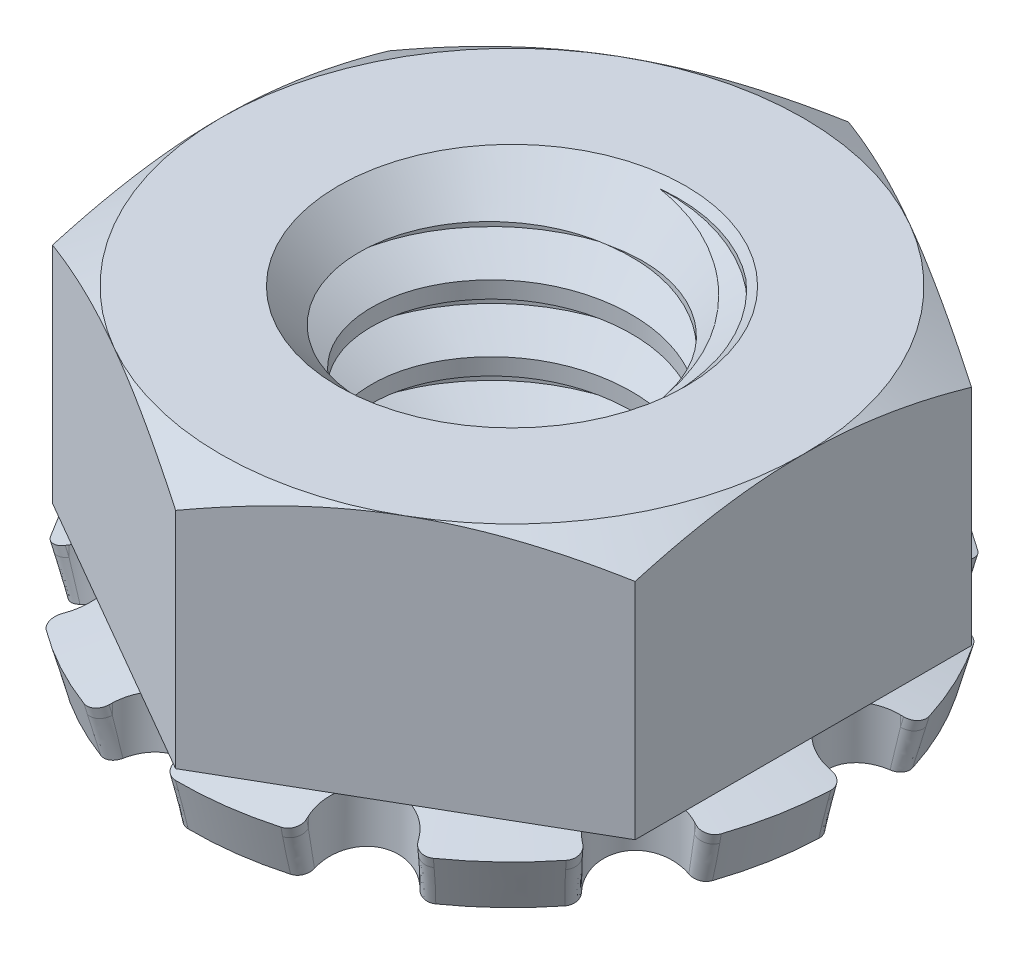
from build123d import *

# Parameters (mm, degrees)
BOSS_EXTRUDE1_DEPTH          = 5.953125
SKETCH2_OUTSIDE_W            = 56.086
SKETCH2_OUTSIDE_H            = 57.806
SKETCH2_OUTSIDE_R            = 5.55625
CUT_EXTRUDE1_DEPTH           = 11.366974651
CUT_EXTRUDE1_DRAFT           = -60
SKETCH4_R                    = 3.175
CUT_EXTRUDE3_DEPTH           = 5.953125
SWEEP1_PITCH                 = 1.27
SKETCH7_R                    = 3.312481533
CUT_EXTRUDE4_OTHER_WAY_DEPTH = 12.17062735
CUT_EXTRUDE4_OTHER_WAY_TAPER = -45
SKETCH8_R                    = 3.312481533
CUT_EXTRUDE5_OTHER_WAY_DEPTH = 11.366974824
CUT_EXTRUDE5_OTHER_WAY_TAPER = -45
SKETCH9_W                    = 2.050179866
SKETCH9_H                    = 1.190625
CUT_EXTRUDE6_DEPTH           = 1.190625
FILLET1_R                    = 0.254
CIRPATTERN1_COUNT            = 10
FILLET1_OF_CIRPATTERN1_R     = 0.254


with BuildPart() as part:
    # Sketch1 → Boss-Extrude1 (new body)
    with BuildSketch(Plane(origin=(0, 0, 0), x_dir=(1, 0, 0), z_dir=(0, 1, 0))):
        Polygon((0, 6.415804866), (-5.55625, 3.207902433), (-5.55625, -3.207902433), (0, -6.415804866), (5.55625, -3.207902433), (5.55625, 3.207902433), align=None)
    extrude(amount=BOSS_EXTRUDE1_DEPTH)


with BuildPart() as cut_extrude1_tool:
    # Sketch2 outside → Cut-Extrude1 (with draft: the straight prism first)
    with BuildSketch(Plane(origin=(0, 5.953125, 0), x_dir=(1, 0, 0), z_dir=(0, 1, 0))):
        Rectangle(SKETCH2_OUTSIDE_W, SKETCH2_OUTSIDE_H)
        Circle(SKETCH2_OUTSIDE_R, mode=Mode.SUBTRACT)
    extrude(amount=-CUT_EXTRUDE1_DEPTH)
    # Cut-Extrude1: the draft: its side faces are tilted about the plane it starts from
    cut_extrude1_sides = [cut_extrude1_tool.faces().sort_by_distance(p)[0] for p in [
        (0, 0.269637675, 28.903),
        (28.043, 0.269637675, 0),
        (0, 0.269637675, -28.903),
        (-28.043, 0.269637675, 0),
        (-5.55625, 0.269637675, 0),
    ]]
    draft(cut_extrude1_sides, Plane(origin=(0, 5.953125, 0), x_dir=(1, 0, 0), z_dir=(0, 1, 0)), CUT_EXTRUDE1_DRAFT)


with BuildPart() as part_1:
    add(part.part)

    # Cut-Extrude1: cut by cut_extrude1_tool
    add(cut_extrude1_tool.part, mode=Mode.SUBTRACT)

    # Sketch4 → Cut-Extrude3 (cut)
    with BuildSketch(Plane(origin=(0, 5.953125, 0), x_dir=(1, 0, 0), z_dir=(0, 1, 0))):
        with Locations(Location((0, 0, 0), (0, 0, 270))):
            Circle(SKETCH4_R)
    extrude(amount=-CUT_EXTRUDE3_DEPTH, mode=Mode.SUBTRACT)

    # Sweep1: the profile of Sketch6 screwed along a right-hand helix of 5.6875 turns, 8 arcs to a turn; built about Z, then put on its axis
    sweep1_z = Axis((0, 0, 0), (0, 0, 1))
    sweep1_corners = [(3.243740766, 0, -1.1509375), (2.487592336, 0, -0.714375), (2.487592336, 0, -0.396875), (3.243740766, 0, 0.0396875)]
    with BuildLine(mode=Mode.PRIVATE) as sweep1_profile:
        Line(sweep1_corners[0], sweep1_corners[1])
        Line(sweep1_corners[1], sweep1_corners[2])
        Line(sweep1_corners[2], sweep1_corners[3])
        Line(sweep1_corners[3], sweep1_corners[0])
    sweep1_cap = Face(sweep1_profile.wire())
    sweep1_turn_angles = [0, 22.5, 45, 67.5, 90, 112.5, 135, 157.5, 180, 202.5, 225, 247.5, 270, 292.5, 315, 337.5, 360]
    sweep1_turn_weights = [1, 0.9238795325112867, 1, 0.9238795325112867, 1, 0.9238795325112867, 1, 0.9238795325112867, 1, 0.9238795325112867, 1, 0.9238795325112867, 1, 0.9238795325112867, 1, 0.9238795325112867, 1]
    sweep1_turn_rails = [Edge.make_bspline([Vector(p[0], p[1], 0).rotate(sweep1_z, sweep1_turn_angles[k]) / sweep1_turn_weights[k] + Vector(0, 0, p[2] + SWEEP1_PITCH * sweep1_turn_angles[k] / 360) for k in range(17)], [0, 0, 0, 1, 1, 2, 2, 3, 3, 4, 4, 5, 5, 6, 6, 7, 7, 8, 8, 8], 2, sweep1_turn_weights) for p in sweep1_corners]
    sweep1_turn_sides = [Face.make_surface_from_curves(sweep1_turn_rails[p[0]], sweep1_turn_rails[p[1]]) for p in [(0, 1), (1, 2), (2, 3), (3, 0)]]
    sweep1_last_angles = [1800, 1822.5, 1845, 1867.5, 1890, 1912.5, 1935, 1957.5, 1980, 2002.5, 2025, 2036.25, 2047.5]
    sweep1_last_weights = [1, 0.9238795325112867, 1, 0.9238795325112867, 1, 0.9238795325112867, 1, 0.9238795325112867, 1, 0.9238795325112867, 1, 0.9807852804032247, 1]
    sweep1_last_rails = [Edge.make_bspline([Vector(p[0], p[1], 0).rotate(sweep1_z, sweep1_last_angles[k]) / sweep1_last_weights[k] + Vector(0, 0, p[2] + SWEEP1_PITCH * sweep1_last_angles[k] / 360) for k in range(13)], [0, 0, 0, 1, 1, 2, 2, 3, 3, 4, 4, 5, 5, 6, 6, 6], 2, sweep1_last_weights) for p in sweep1_corners]
    sweep1_last_sides = [Face.make_surface_from_curves(sweep1_last_rails[p[0]], sweep1_last_rails[p[1]]) for p in [(0, 1), (1, 2), (2, 3), (3, 0)]]
    sweep1 = Plane(origin=(0, 5.953125, 0), x_dir=(0, 0, -1), z_dir=(0, -1, 0)) * Solid(Shell([*[p.moved(Location((0, 0, SWEEP1_PITCH * i))) for i in range(5) for p in sweep1_turn_sides], *sweep1_last_sides, sweep1_cap, sweep1_cap.rotate(sweep1_z, 2047.5).moved(Location((0, 0, SWEEP1_PITCH * 2047.5 / 360)))]))
    add(sweep1)

    # Cut-Extrude4 cone 1 section (through the dimple's axis) → Cut-Extrude4 (revolve, cut)
    with BuildSketch(Plane(origin=(0, 5.953125, 0), x_dir=(0, 0, 1), z_dir=(1, 0, 0))):
        Polygon((0, 0), (3.312481533, 0), (0, 3.312481533), align=None)
    revolve(axis=Axis((0, 5.953125, 0), (0, -1, 0)), mode=Mode.SUBTRACT)

    # Sketch7 → Cut-Extrude4 other way (cut)
    with BuildSketch(Plane(origin=(0, 5.953125, 0), x_dir=(1, 0, 0), z_dir=(0, 1, 0))):
        Circle(SKETCH7_R)
    extrude(amount=CUT_EXTRUDE4_OTHER_WAY_DEPTH, taper=CUT_EXTRUDE4_OTHER_WAY_TAPER, mode=Mode.SUBTRACT)

    # Cut-Extrude5 cone 1 section (through the dimple's axis) → Cut-Extrude5 (revolve, cut)
    with BuildSketch(Plane(origin=(0, 0, 0), x_dir=(0, 0, -1), z_dir=(1, 0, 0))):
        Polygon((0, 0), (3.312481533, 0), (0, 3.312481533), align=None)
    revolve(axis=Axis((0, 0, 0), (0, 1, 0)), mode=Mode.SUBTRACT)

    # Sketch8 → Cut-Extrude5 other way (cut)
    with BuildSketch(Plane.XZ):
        Circle(SKETCH8_R)
    extrude(amount=CUT_EXTRUDE5_OTHER_WAY_DEPTH, taper=CUT_EXTRUDE5_OTHER_WAY_TAPER, mode=Mode.SUBTRACT)

    # Sketch9 → Cut-Revolve1 (revolve, cut)
    with BuildSketch(Plane(origin=(0, 0, 0), x_dir=(0, 0, -1), z_dir=(1, 0, 0)), mode=Mode.PRIVATE) as cut_revolve1_sk:
        with Locations((5.390714933, 0.5953125)):
            Rectangle(SKETCH9_W, SKETCH9_H)
    revolve(cut_revolve1_sk.sketch.rotate(Axis((0, 0, 0), (0, 1, 0)), 234.052465709), axis=Axis((0, 0, 0), (0, 1, 0)), mode=Mode.SUBTRACT)

    # Sketch10 → Revolve1 (revolve)
    with BuildSketch(Plane(origin=(0, 0, 0), x_dir=(0, 0, -1), z_dir=(1, 0, 0)), mode=Mode.PRIVATE) as revolve1_sk:
        Polygon((4.365625, 1.190625), (5.375009471, 1.190625), (6.35, 0.929377075), (6.100974163, 0), (5.125983634, 0.261247925), (4.365625, 0.261247925), align=None)
    revolve(revolve1_sk.sketch.rotate(Axis((0, 1.190625, 0), (0, -1, 0)), 180), axis=Axis((0, 1.190625, 0), (0, -1, 0)))

    # Sketch11 → Cut-Extrude6 (cut)
    with BuildSketch(Plane(origin=(0, 0, 0), x_dir=(1, 0, 0), z_dir=(0, 1, 0))):
        with BuildLine():
            Line((5.842672321, 1.56553933), (6.133628997, 1.643500936))
            ThreePointArc((6.133628997, 1.643500936), (6.29567487, 0.828841321), (6.35, 0))
            Line((6.35, 0), (6.048779484, 0))
            ThreePointArc((6.048779484, 0), (5.25925533, 0.6923941), (5.842672321, 1.56553933))
        make_face()
    cut_extrude6 = extrude(amount=CUT_EXTRUDE6_DEPTH, mode=Mode.SUBTRACT)

    # Fillet1
    fillet1_edges = [part_1.edges().sort_by_distance(p)[0] for p in [
        (6.013358753, 0.464688538, -1.611274622),
        (6.225487082, 0.464688538, 0),
    ]]
    fillet(fillet1_edges, radius=FILLET1_R)

    # CirPattern1: Cut-Extrude6 ×10 about axis
    cirpattern1_axis = Axis((0, 0, 0), (0, -1, 0))
    for i in range(1, CIRPATTERN1_COUNT):
        add(cut_extrude6.rotate(cirpattern1_axis, i * 360 / CIRPATTERN1_COUNT), mode=Mode.SUBTRACT)

    # Fillet1 of CirPattern1
    fillet1_of_cirpattern1_edges = [part_1.edges().sort_by_distance(p)[0] for p in [
        (5.811992885, 0.464688538, 2.23101504),
        (5.036524847, 0.464688538, 3.659249495),
        (3.390643277, 0.464688538, 5.221132786),
        (1.923781306, 0.464688538, 5.920790056),
        (-0.325816819, 0.464688538, 6.216955268),
        (-1.923781306, 0.464688538, 5.920790056),
        (-3.917825965, 0.464688538, 4.838112144),
        (-5.036524847, 0.464688538, 3.659249495),
        (-6.013358753, 0.464688538, 1.611274622),
        (-6.225487082, 0.464688538, 0),
        (-5.811992885, 0.464688538, -2.23101504),
        (-5.036524847, 0.464688538, -3.659249495),
        (-3.390643277, 0.464688538, -5.221132786),
        (-1.923781306, 0.464688538, -5.920790056),
        (0.325816819, 0.464688538, -6.216955268),
        (1.923781306, 0.464688538, -5.920790056),
        (3.917825965, 0.464688538, -4.838112144),
        (5.036524847, 0.464688538, -3.659249495),
    ]]
    fillet(fillet1_of_cirpattern1_edges, radius=FILLET1_OF_CIRPATTERN1_R)


solid = part_1.part
